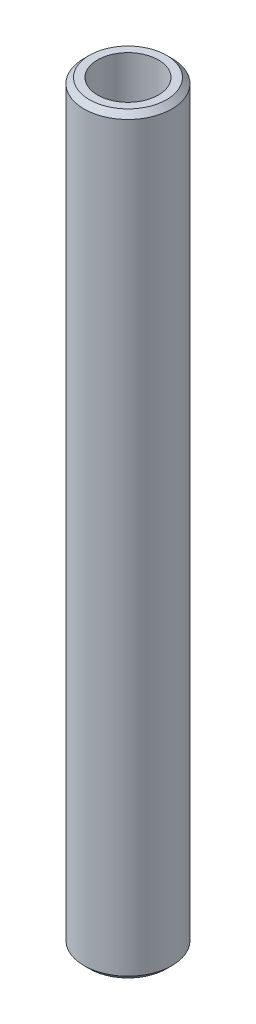
from build123d import *

# Parameters (mm, degrees)
SKETCH1_R           = 35
BOSS_EXTRUDE1_DEPTH = 600
SKETCH2_R           = 24.268624872
CUT_EXTRUDE1_DEPTH  = 603.038204768
CHAMFER1_SIZE       = 4.275409501


with BuildPart() as part:
    # Sketch1 → Boss-Extrude1 (new body)
    with BuildSketch(Plane(origin=(0, 0, 0), x_dir=(1, 0, 0), z_dir=(0, 1, 0))):
        Circle(SKETCH1_R)
    extrude(amount=BOSS_EXTRUDE1_DEPTH)

    # Sketch2 → Cut-Extrude1 (cut, through all)
    with BuildSketch(Plane(origin=(0, 0, 0), x_dir=(1, 0, 0), z_dir=(0, 1, 0))):
        Circle(SKETCH2_R)
    extrude(amount=CUT_EXTRUDE1_DEPTH, mode=Mode.SUBTRACT)

    # Chamfer1
    chamfer1_edges = [part.edges().sort_by_distance(p)[0] for p in [
        (-35, 600, 0),
        (-35, 0, 0),
    ]]
    chamfer(chamfer1_edges, length=CHAMFER1_SIZE)


solid = part.part
